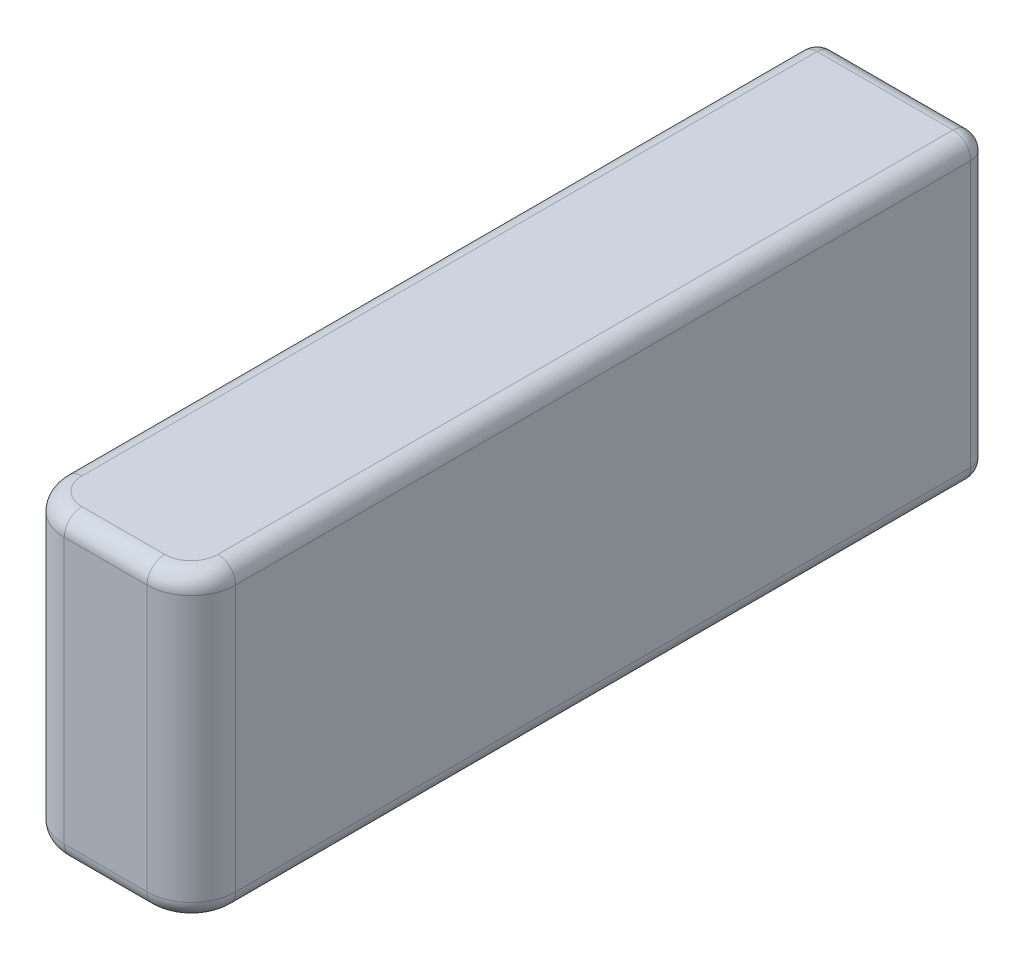
from build123d import *

# Parameters (mm, degrees)
ESQUISSE1_W        = 19.35
ESQUISSE1_H        = 34
BOSS_EXTRU_1_DEPTH = 90
CONG_1_R           = 2
CONG_2_R           = 5


with BuildPart() as part:
    # Esquisse1 → Boss.-Extru.1 (new body)
    with BuildSketch(Plane.XY):
        with Locations((9.675, 17)):
            Rectangle(ESQUISSE1_W, ESQUISSE1_H)
    extrude(amount=BOSS_EXTRU_1_DEPTH)

    # Congé1
    cong_1_edges = [part.edges().sort_by_distance(p)[0] for p in [
        (9.675, 34, 90),
        (9.675, 34, 0),
        (19.35, 17, 0),
        (9.675, 0, 0),
        (0, 17, 0),
        (9.675, 0, 90),
        (0, 34, 45),
        (19.35, 34, 45),
        (19.35, 0, 45),
        (0, 0, 45),
    ]]
    fillet(cong_1_edges, radius=CONG_1_R)

    # Congé2
    # the kernel refuses this fillet: 5 mm, written as the material it takes off along each edge
    with BuildSketch(Plane(origin=(14.35, 0, 85), x_dir=(1, 0, 0), z_dir=(0, 0, -1))) as cong_2_piece_1:
        with BuildLine():
            CenterArc((3, -2), 2, 0, 90)
            Line((5, -2), (5, 0))
            Line((5, 0), (3, 0))
        make_face()
    revolve(axis=Axis((14.35, 0, 85), (0, -1, 0)), revolution_arc=90, mode=Mode.SUBTRACT)
    with BuildSketch(Plane(origin=(5, 0, 85), x_dir=(0, 0, 1), z_dir=(1, 0, 0))) as cong_2_piece_2:
        with BuildLine():
            CenterArc((3, -2), 2, 0, 90)
            Line((5, -2), (5, 0))
            Line((5, 0), (3, 0))
        make_face()
    revolve(axis=Axis((5, 0, 85), (0, -1, 0)), revolution_arc=90, mode=Mode.SUBTRACT)
    with BuildSketch(Plane(origin=(14.35, 34, 85), x_dir=(0, 0, 1), z_dir=(-1, 0, 0))) as cong_2_piece_3:
        with BuildLine():
            CenterArc((3, -2), 2, 0, 90)
            Line((5, -2), (5, 0))
            Line((5, 0), (3, 0))
        make_face()
    revolve(axis=Axis((14.35, 34, 85), (0, 1, 0)), revolution_arc=90, mode=Mode.SUBTRACT)
    with BuildSketch(Plane(origin=(5, 34, 85), x_dir=(-1, 0, 0), z_dir=(0, 0, -1))) as cong_2_piece_4:
        with BuildLine():
            CenterArc((3, -2), 2, 0, 90)
            Line((5, -2), (5, 0))
            Line((5, 0), (3, 0))
        make_face()
    revolve(axis=Axis((5, 34, 85), (0, 1, 0)), revolution_arc=90, mode=Mode.SUBTRACT)
    with BuildSketch(Plane(origin=(0, 34, 90), x_dir=(0, 0, -1), z_dir=(0, -1, 0)), Plane(origin=(19.35, 0, 90), x_dir=(0, 0, -1), z_dir=(0, 1, 0))) as cong_2_piece_5:
        with BuildLine():
            CenterArc((CONG_2_R, CONG_2_R), CONG_2_R, 180, 90)
            Line((0, CONG_2_R), (0, 0))
            Line((0, 0), (CONG_2_R, 0))
        make_face()
    extrude(amount=34, mode=Mode.SUBTRACT)


solid = part.part
